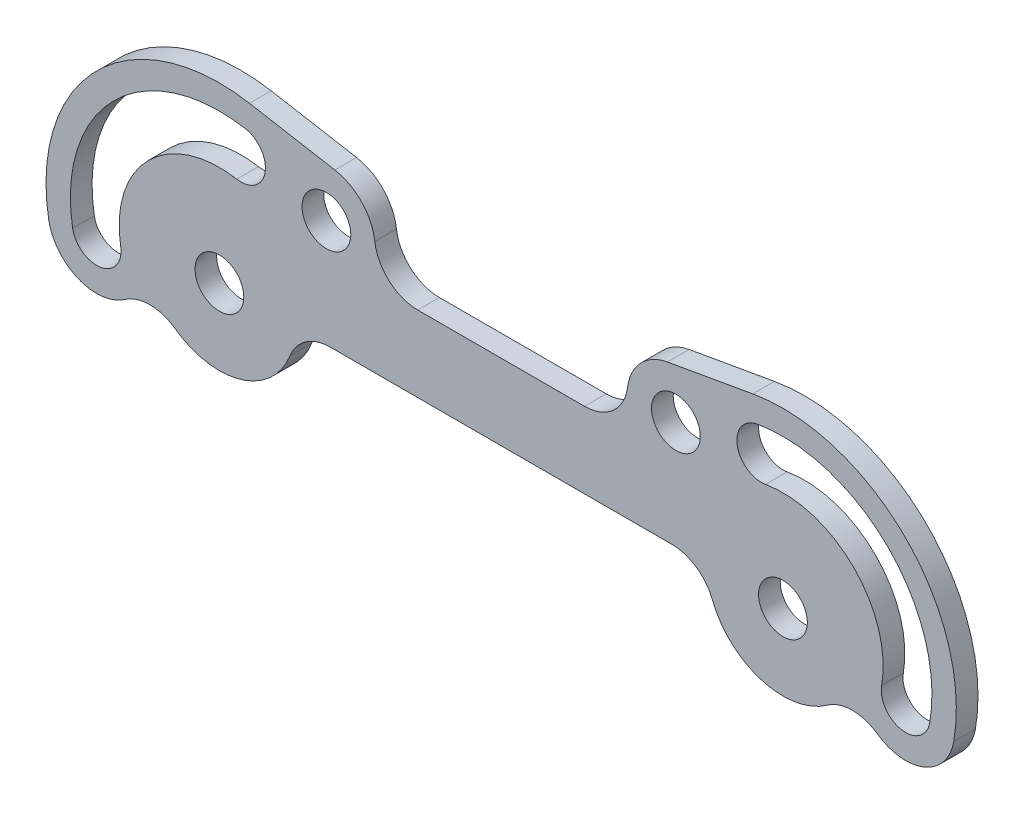
from build123d import *

# Parameters (mm, degrees)
SKETCH1_R            = 1.7859375
BOSS_EXTRUDE1_DEPTH  = 1.5875
FILLET1_R            = 3.175
FILLET1_OF_MIRROR1_R = 3.175


with BuildPart() as part:
    # Sketch1 → Boss-Extrude1 (new body)
    with BuildSketch(Plane.XY):
        with BuildLine():
            Line((-15.08125, 0), (0, 0))
            Line((0, 0), (0, 5.55625))
            Line((0, 5.55625), (-10.092061938, 5.55625))
            ThreePointArc((-10.092061938, 5.55625), (-9.43473159, 9.087090354), (-12.178638912, 11.404392535))
            Line((-12.178638912, 11.404392535), (-18.432168144, 12.507058463))
            ThreePointArc((-18.432168144, 12.507058463), (-29.617756121, 8.980256121), (-33.144558463, -2.205331856))
            ThreePointArc((-33.144558463, -2.205331856), (-29.006698655, -5.102692459), (-26.109338088, -0.964832626))
            ThreePointArc((-26.109338088, -0.964832626), (-20.153240935, -5.535106794), (-15.08125, 0))
        make_face()
        with Locations((-20.6375, 0)):
            Circle(SKETCH1_R, mode=Mode.SUBTRACT)
        with BuildLine():
            ThreePointArc((-19.362542521, 7.230643174), (-25.82921057, 5.19171057), (-27.868143174, -1.274957479))
            ThreePointArc((-27.868143174, -1.274957479), (-29.316823478, -3.343887368), (-31.385753367, -1.895207064))
            ThreePointArc((-31.385753367, -1.895207064), (-28.354907604, 7.717407604), (-18.742292936, 10.748253367))
            ThreePointArc((-18.742292936, 10.748253367), (-17.293612632, 8.679323478), (-19.362542521, 7.230643174))
        make_face(mode=Mode.SUBTRACT)
        with Locations((-12.798888497, 7.886782342)):
            Circle(SKETCH1_R, mode=Mode.SUBTRACT)
    boss_extrude1 = extrude(amount=BOSS_EXTRUDE1_DEPTH)

    # Fillet1
    fillet1_edges = [part.edges().sort_by_distance(p)[0] for p in [
        (-26.109338088, -0.964832626, 0.79375),
        (-15.08125, 0, 0.79375),
        (-10.092061938, 5.55625, 0.79375),
    ]]
    fillet(fillet1_edges, radius=FILLET1_R)

    # Mirror1: Boss-Extrude1 across plane
    add(boss_extrude1.mirror(Plane(origin=(0, 0, 1.5875), x_dir=(0, 0, 1), z_dir=(1, 0, 0))))

    # Fillet1 of Mirror1
    fillet1_of_mirror1_edges = [part.edges().sort_by_distance(p)[0] for p in [
        (26.109338088, -0.964832626, 0.79375),
        (15.08125, 0, 0.79375),
        (10.092061938, 5.55625, 0.79375),
    ]]
    fillet(fillet1_of_mirror1_edges, radius=FILLET1_OF_MIRROR1_R)


solid = part.part
